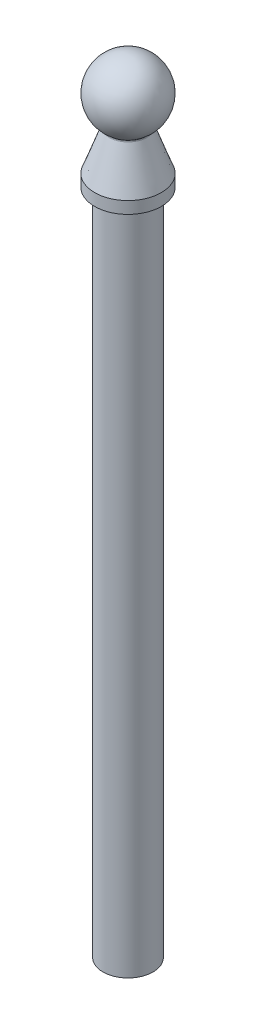
from build123d import *

# Parameters (mm, degrees)
SKETCH1_R           = 30
EXTRUDE1_DEPTH      = 800
SKETCH_1_R          = 10
CUT_EXTRUDE_1_DEPTH = 35.6


# Read off the part's stored shape, not the designer's step: 连接重组1
with BuildPart() as part:
    # Sketch1 → Extrude1 (new body)
    with BuildSketch(Plane(origin=(0, 0, 0), x_dir=(1, 0, 0), z_dir=(0, 1, 0))):
        with Locations(Location((0, 0, 0), (0, 0, 270))):
            Circle(SKETCH1_R)
    extrude(amount=-EXTRUDE1_DEPTH)

    # 草图1 → 切除-拉伸1 (cut)
    with BuildSketch(Plane(origin=(0, 0, 0), x_dir=(1, 0, 0), z_dir=(0, 1, 0))):
        with Locations(Location((0, 0, 0), (0, 0, 270))):
            Circle(SKETCH_1_R)
    extrude(amount=-CUT_EXTRUDE_1_DEPTH, mode=Mode.SUBTRACT)

    # 连接重组1 outline → 连接重组1 (revolve)
    with BuildSketch(Plane.XY):
        with BuildLine():
            ThreePointArc((22.543988515, 62.888907458), (22.516451416, 64.161768918), (23.262631751, 65.193345138))
            ThreePointArc((23.262631751, 65.193345138), (38.089361999, 109.948085758), (0, 137.73332))
            Line((0, 137.73332), (0, -35.6))
            Line((0, -35.6), (10, -35.6))
            Line((10, -35.6), (10, 0))
            Line((10, 0), (30, 0))
            Line((30, 0), (39.999998202, -3.56e-06))
            Line((39.999998202, -3.56e-06), (39.999998202, 14.399991661))
            Line((39.999998202, 14.399991661), (22.543988515, 62.888907458))
        make_face()
    revolve(axis=Axis((0, 0, 0), (0, 1, 0)))


solid = part.part
